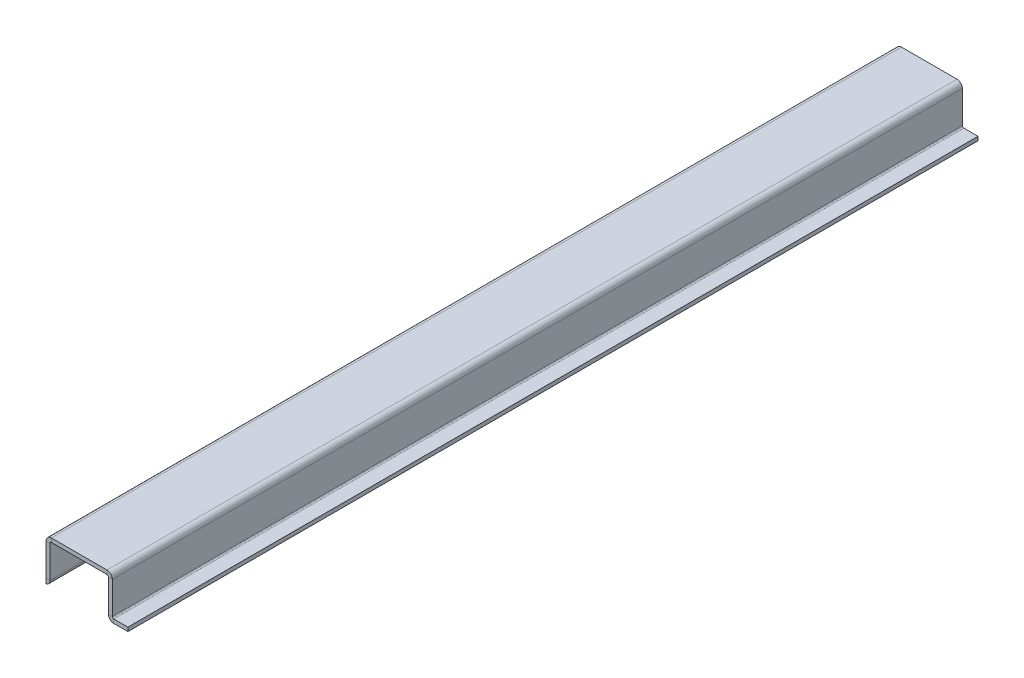
from build123d import *

# Parameters (mm, degrees)
SM_BASE_FLANGE_1_DEPTH   = 436
CUT_EXTRUDE_1_DEPTH      = 10
CUT_EXTRUDE_1_DEPTH_BACK = 10
SKETCH_2_W               = 12.842994449
SKETCH_2_H               = 79.921875175
SKETCH_2_W_2             = 14.142108975
SKETCH_2_H_2             = 88.32377597


# Sheet-metal steps are written as plain solids
with BuildPart() as part:
    # Sketch 1 → 基体-法兰1 (new body)
    with BuildSketch(Plane.XY):
        with BuildLine():
            Line((-10, 0), (-2.7366, 0))
            ThreePointArc((-2.7366, 0), (-0.801531583, 0.801531583), (0, 2.7366))
            Line((0, 2.7366), (0, 19.2634))
            ThreePointArc((0, 19.2634), (0.215745145, 19.784254855), (0.7366, 20))
            Line((0.7366, 20), (29.2634, 20))
            ThreePointArc((29.2634, 20), (29.784254855, 19.784254855), (30, 19.2634))
            Line((30, 19.2634), (30, 2.7366))
            ThreePointArc((30, 2.7366), (30.801531583, 0.801531583), (32.7366, 0))
            Line((32.7366, 0), (40, 0))
            Line((40, 0), (40, 2))
            Line((40, 2), (32.7366, 2))
            ThreePointArc((32.7366, 2), (32.215745145, 2.215745145), (32, 2.7366))
            Line((32, 2.7366), (32, 19.2634))
            ThreePointArc((32, 19.2634), (31.198468417, 21.198468417), (29.2634, 22))
            Line((29.2634, 22), (0.7366, 22))
            ThreePointArc((0.7366, 22), (-1.198468417, 21.198468417), (-2, 19.2634))
            Line((-2, 19.2634), (-2, 2.7366))
            ThreePointArc((-2, 2.7366), (-2.215745145, 2.215745145), (-2.7366, 2))
            Line((-2.7366, 2), (-10, 2))
            Line((-10, 2), (-10, 0))
        make_face()
    extrude(amount=SM_BASE_FLANGE_1_DEPTH)

    # Sketch 2 → 切除-拉伸1 (cut, two sides: drawn at the far end of the back side and taken through both)
    with BuildSketch(Plane(origin=(0, 2, 0), x_dir=(1, 0, 0), z_dir=(0, 1, 0)).offset(-CUT_EXTRUDE_1_DEPTH_BACK)):
        with Locations((-8.421497225, -36.039062413)):
            Rectangle(SKETCH_2_W, SKETCH_2_H)
        with Locations((-9.071054487, -404.161887985)):
            Rectangle(SKETCH_2_W_2, SKETCH_2_H_2)
    extrude(amount=CUT_EXTRUDE_1_DEPTH + CUT_EXTRUDE_1_DEPTH_BACK, mode=Mode.SUBTRACT)


solid = part.part
